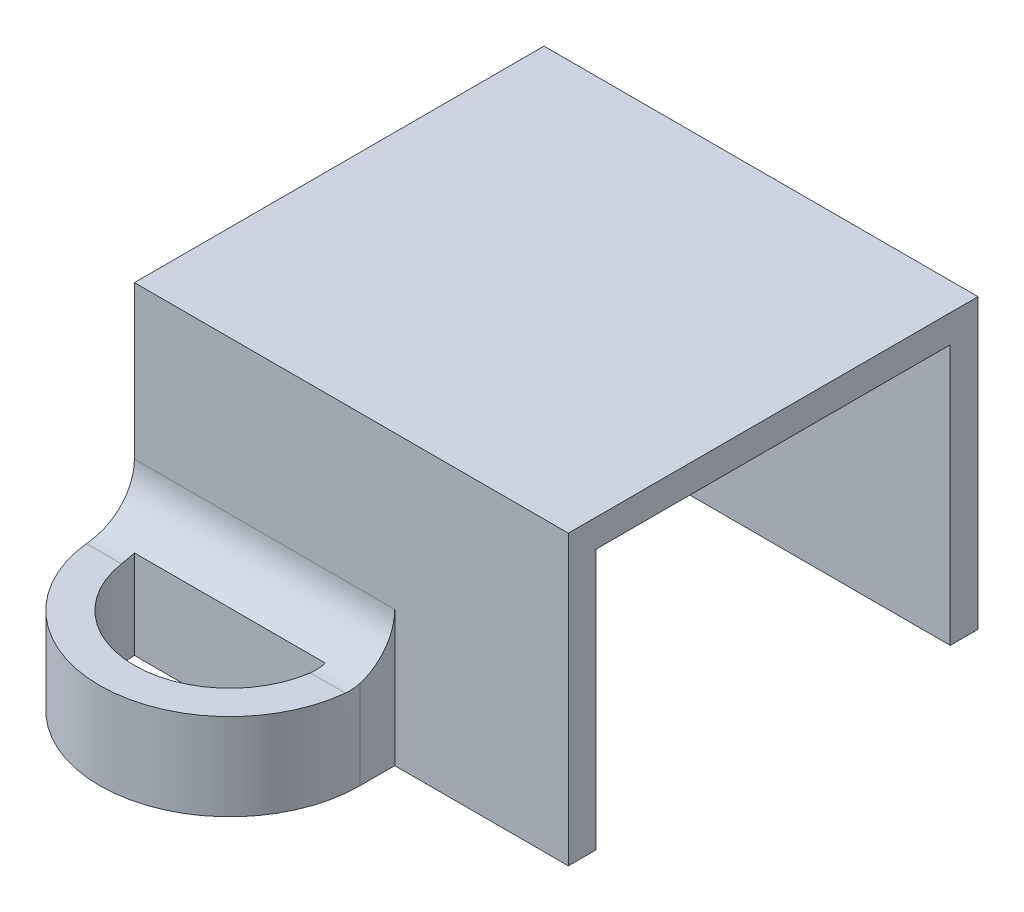
from build123d import *

# Parameters (mm, degrees)
BOSS_EXTRUDE1_DEPTH = 15.875
BOSS_EXTRUDE2_DEPTH = 3.175
CUT_EXTRUDE1_REACH  = 24.393
FILLET2_R           = 1.778
FILLET3_R           = 1.778


with BuildPart() as part:
    # Sketch1 → Boss-Extrude1 (new body)
    with BuildSketch(Plane(origin=(0, 0, 0), x_dir=(0, 0, -1), z_dir=(1, 0, 0))):
        Polygon((0, 0), (-1.016, 0), (-1.016, 10.541), (13.97, 10.541), (13.97, 0), (12.954, 0), (12.954, 9.525), (0, 9.525), align=None)
    extrude(amount=BOSS_EXTRUDE1_DEPTH)

    # Sketch2 → Boss-Extrude2 (add)
    with BuildSketch(Plane.XZ):
        with BuildLine():
            Line((9.525, 2.286), (9.525, 1.016))
            Line((9.525, 1.016), (0, 1.016))
            Line((0, 1.016), (0, 2.286))
            ThreePointArc((0, 2.286), (4.7625, 7.0485), (9.525, 2.286))
        make_face()
    boss_extrude2 = extrude(amount=-BOSS_EXTRUDE2_DEPTH)

    # Sketch4 → Cut-Extrude1 (cut, up to next)
    with BuildSketch(Plane(origin=(0, 3.175, 0), x_dir=(1, 0, 0), z_dir=(0, 1, 0)), mode=Mode.PRIVATE) as cut_extrude1_sk1:
        with BuildLine():
            Line((8.255, -2.286), (1.27, -2.286))
            ThreePointArc((1.27, -2.286), (4.7625, -5.7785), (8.255, -2.286))
        make_face()
    cut_extrude1_tool1 = extrude(cut_extrude1_sk1.sketch, amount=-CUT_EXTRUDE1_REACH, mode=Mode.PRIVATE) & part.part
    cut_extrude1 = cut_extrude1_tool1.solids().sort_by_distance((4.7625, 3.175, 3.768263))[0]
    add(cut_extrude1, mode=Mode.SUBTRACT)

    # Fillet2
    # the kernel refuses this fillet: 1.778 mm, written as the material it adds along each edge
    with BuildSketch(Plane(origin=(9.525, 3.175, 1.016), x_dir=(0, 1, 0), z_dir=(-1, 0, 0))) as fillet2_piece_1_section:
        with BuildLine():
            CenterArc((FILLET2_R, -FILLET2_R), FILLET2_R, 90, 90)
            Line((0, -FILLET2_R), (0, 0))
            Line((0, 0), (FILLET2_R, 0))
        make_face()
    fillet2_piece_1 = extrude(amount=9.525, mode=Mode.PRIVATE)
    fillet2_piece_1 = split(fillet2_piece_1, bisect_by=Plane(origin=(9.463917271, 3.688621556, 2.286), z_dir=(0, 0, -1)), keep=Keep.TOP, mode=Mode.PRIVATE)
    add(fillet2_piece_1)
    with BuildSketch(Plane(origin=(13.97, 3.175, 1.016), x_dir=(0, 1, 0), z_dir=(-1, 0, 0))) as fillet2_piece_2_section:
        with BuildLine():
            CenterArc((FILLET2_R, -FILLET2_R), FILLET2_R, 90, 90)
            Line((0, -FILLET2_R), (0, 0))
            Line((0, 0), (FILLET2_R, 0))
        make_face()
    fillet2_piece_2 = extrude(amount=18.415, mode=Mode.PRIVATE)
    fillet2_piece_2 = fillet2_piece_2 & Plane(origin=(4.7625, 3.197144068, 2.286), x_dir=(-1, 0, 0), z_dir=(0, -1, 0)) * Cylinder(4.7625, 44, mode=Mode.PRIVATE)
    fillet2_piece_2 = fillet2_piece_2 - Plane(origin=(4.7625, 3.197144068, 2.286), x_dir=(-1, 0, 0), z_dir=(0, 1, 0)) * Cylinder(3.4925, 44, mode=Mode.PRIVATE)
    add(fillet2_piece_2)

    # Mirror2: Boss-Extrude2 across plane
    add(boss_extrude2.mirror(Plane.XY.offset(-6.477)))

    # Mirror3: Cut-Extrude1 across plane
    add(cut_extrude1.mirror(Plane.XY.offset(-6.477)), mode=Mode.SUBTRACT)

    # Fillet3
    # the kernel refuses this fillet: 1.778 mm, written as the material it adds along each edge
    with BuildSketch(Plane(origin=(9.525, 3.175, -13.97), x_dir=(0, 0, -1), z_dir=(-1, 0, 0))) as fillet3_piece_1_section:
        with BuildLine():
            CenterArc((FILLET3_R, -FILLET3_R), FILLET3_R, 90, 90)
            Line((0, -FILLET3_R), (0, 0))
            Line((0, 0), (FILLET3_R, 0))
        make_face()
    fillet3_piece_1 = extrude(amount=9.525, mode=Mode.PRIVATE)
    fillet3_piece_1 = split(fillet3_piece_1, bisect_by=Plane(origin=(9.46391727, 3.688621585, -15.24), z_dir=(0, 0, 1)), keep=Keep.TOP, mode=Mode.PRIVATE)
    add(fillet3_piece_1)
    with BuildSketch(Plane(origin=(13.97, 3.175, -13.97), x_dir=(0, 0, -1), z_dir=(-1, 0, 0))) as fillet3_piece_2_section:
        with BuildLine():
            CenterArc((FILLET3_R, -FILLET3_R), FILLET3_R, 90, 90)
            Line((0, -FILLET3_R), (0, 0))
            Line((0, 0), (FILLET3_R, 0))
        make_face()
    fillet3_piece_2 = extrude(amount=18.415, mode=Mode.PRIVATE)
    fillet3_piece_2 = fillet3_piece_2 & Plane(origin=(4.7625, 3.197144068, -15.24), x_dir=(-1, 0, 0), z_dir=(0, -1, 0)) * Cylinder(4.7625, 44, mode=Mode.PRIVATE)
    fillet3_piece_2 = fillet3_piece_2 - Plane(origin=(4.7625, 3.197144068, -15.24), x_dir=(-1, 0, 0), z_dir=(0, 1, 0)) * Cylinder(3.4925, 44, mode=Mode.PRIVATE)
    add(fillet3_piece_2)


solid = part.part
